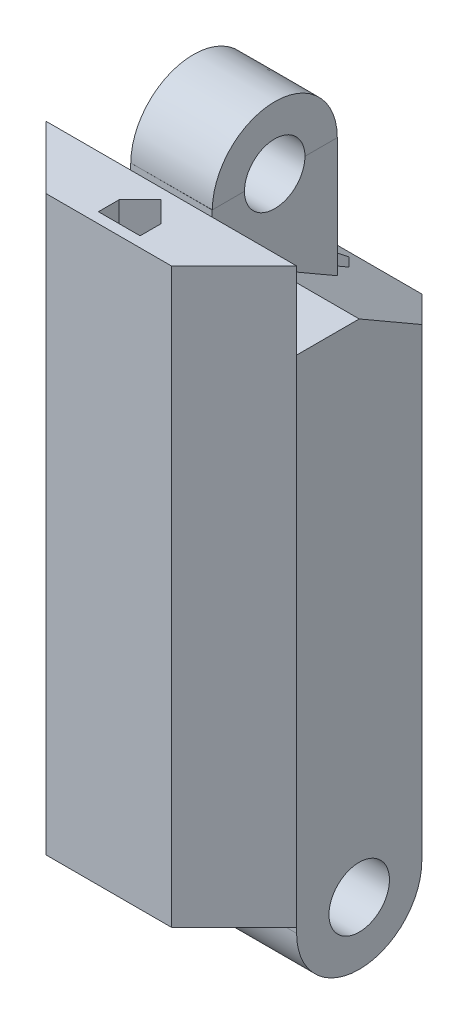
from build123d import *

# Parameters (mm, degrees)
BOSS_EXTRUDE1_DEPTH     = 10
CUT_EXTRUDE2_DEPTH      = 14.114877049
SKETCH6_W               = 3.9
SKETCH6_H               = 6
BOSS_EXTRUDE3_DEPTH     = 4
SKETCH7_W               = 3.9
SKETCH7_H               = 3
REVOLVE1_ANGLE          = 180
SKETCH9_R               = 1.45
CUT_EXTRUDE3_DEPTH      = 5
SKETCH10_W              = 3.9
SKETCH10_H              = 6
BOSS_EXTRUDE4_DEPTH     = 4
REVOLVE2_ANGLE          = 180
SKETCH14_R              = 1.45
CUT_EXTRUDE4_DEPTH      = 5
BOSS_EXTRUDE7_DEPTH     = 3.7
BOSS_EXTRUDE17_DEPTH    = 3.75
CUT_EXTRUDE6_DEPTH      = 20
CUT_EXTRUDE6_DEPTH_BACK = 20


with BuildPart() as part:
    # Sketch2 → Boss-Extrude1 (new, symmetric)
    with BuildSketch(Plane(origin=(0, 0, 0), x_dir=(1, 0, 0), z_dir=(0, 1, 0))):
        Polygon((-3, 6), (3, 6), (6, 3), (6, -3), (3, -6), (-3, -6), (-6, -3), (-6, 3), align=None)
    extrude(amount=BOSS_EXTRUDE1_DEPTH, both=True)

    # Sketch5 → Cut-Extrude2 (cut, symmetric)
    with BuildSketch(Plane(origin=(0, 0, 0), x_dir=(0, 0, -1), z_dir=(1, 0, 0))):
        Polygon((0, 10), (6, 6.535898385), (6, 10), align=None)
    cut_extrude2 = extrude(amount=CUT_EXTRUDE2_DEPTH, both=True, mode=Mode.SUBTRACT)

    # Mirror3: Cut-Extrude2 across plane
    add(cut_extrude2.mirror(Plane.ZX), mode=Mode.SUBTRACT)

    # Sketch6 → Boss-Extrude3 (add, symmetric)
    with BuildSketch(Plane.XZ.offset(10)):
        with Locations((-4.05, 0)):
            Rectangle(SKETCH6_W, SKETCH6_H)
    boss_extrude3 = extrude(amount=BOSS_EXTRUDE3_DEPTH, both=True)

    # Sketch7 → Revolve1 (revolve)
    with BuildSketch(Plane.XZ.offset(14)):
        with Locations((-4.05, 1.5)):
            Rectangle(SKETCH7_W, SKETCH7_H)
    revolve1 = revolve(axis=Axis((-6, -14, 0), (1, 0, 0)), revolution_arc=REVOLVE1_ANGLE)

    # Sketch9 → Cut-Extrude3 (cut, symmetric)
    with BuildSketch(Plane.ZY.offset(6)):
        with Locations((0, -14)):
            Circle(SKETCH9_R)
    cut_extrude3 = extrude(amount=CUT_EXTRUDE3_DEPTH, both=True, mode=Mode.SUBTRACT)

    # Mirror5: Boss-Extrude3, Revolve1, Cut-Extrude3 across plane
    add(boss_extrude3.mirror(Plane(origin=(0, 0, 0), x_dir=(0, 0, 1), z_dir=(1, 0, 0))))
    add(revolve1.mirror(Plane(origin=(0, 0, 0), x_dir=(0, 0, 1), z_dir=(1, 0, 0))))
    add(cut_extrude3.mirror(Plane(origin=(0, 0, 0), x_dir=(0, 0, 1), z_dir=(1, 0, 0))), mode=Mode.SUBTRACT)

    # Sketch10 → Boss-Extrude4 (add, symmetric)
    with BuildSketch(Plane(origin=(0, 10, 0), x_dir=(1, 0, 0), z_dir=(0, 1, 0))):
        Rectangle(SKETCH10_W, SKETCH10_H)
    extrude(amount=BOSS_EXTRUDE4_DEPTH, both=True)

    # Sketch12 → Revolve2 (revolve)
    with BuildSketch(Plane(origin=(0, 14, 0), x_dir=(1, 0, 0), z_dir=(0, 1, 0))):
        Polygon((-1.95, 3), (-1.95, 0), (1.95, 0.003655936), (1.95, 3), align=None)
    revolve(axis=Axis((-1.95, 14, 0), (0.9999995606226393, 0, -0.0009374190783233235)), revolution_arc=REVOLVE2_ANGLE)

    # Sketch14 → Cut-Extrude4 (cut, symmetric)
    with BuildSketch(Plane.ZY.offset(1.95)):
        with Locations((0, 14)):
            Circle(SKETCH14_R)
    extrude(amount=CUT_EXTRUDE4_DEPTH, both=True, mode=Mode.SUBTRACT)

    # Sketch17 → Boss-Extrude7 (add)
    with BuildSketch(Plane(origin=(0, 10, 0), x_dir=(1, 0, 0), z_dir=(0, 1, 0))):
        Polygon((-6, -3), (-1.95, -3), (1.95, -3), (6, -3), (3, -6), (-3, -6), align=None)
    extrude(amount=BOSS_EXTRUDE7_DEPTH)

    # Sketch19 → Boss-Extrude17 (add)
    with BuildSketch(Plane.XZ.offset(10)):
        Polygon((-6, 3), (-2.1, 3), (2.1, 3), (6, 3), (3, 6), (-3, 6), align=None)
    extrude(amount=BOSS_EXTRUDE17_DEPTH)

    # Sketch15 → Cut-Extrude6 (cut, two sides: drawn at the far end of the back side and taken through both)
    with BuildSketch(Plane(origin=(0, 0, 0), x_dir=(1, 0, 0), z_dir=(0, 1, 0)).offset(-CUT_EXTRUDE6_DEPTH_BACK)):
        Polygon((0, 5.5), (-1, 4.5), (-1, 3.5), (1, 3.5), (1, 4.5), align=None)
        Polygon((1, -4.5), (0, -3.5), (-1, -4.5), (-1, -5.5), (1, -5.5), align=None)
    extrude(amount=CUT_EXTRUDE6_DEPTH + CUT_EXTRUDE6_DEPTH_BACK, mode=Mode.SUBTRACT)


solid = part.part
